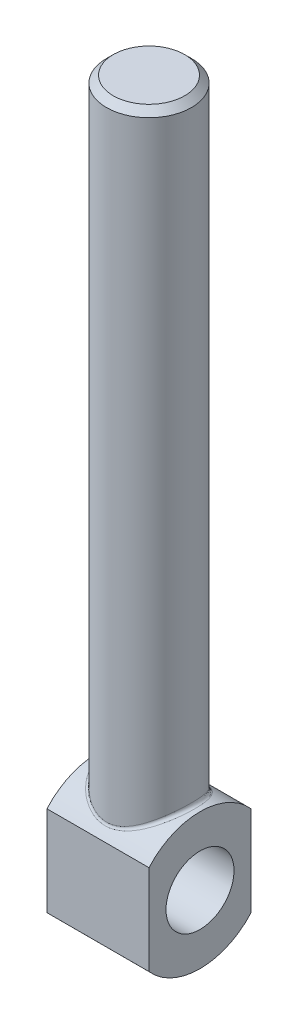
from build123d import *

# Parameters (mm, degrees)
SKETCH1_R           = 2.5
BOSS_EXTRUDE1_DEPTH = 40
SKETCH2_R           = 4
BOSS_EXTRUDE2_DEPTH = 3
CUT_EXTRUDE1_START  = -6
CUT_EXTRUDE1_DEPTH  = 6
SKETCH5_R           = 2
CUT_EXTRUDE2_DEPTH  = 41.558599702
FILLET1_R           = 0.2
CHAMFER1_SIZE       = 0.4
SPLIT1_START        = -3
SPLIT1_OUTLINE_R    = 2
SPLIT1_DEPTH        = 6
SPLIT1_2_OUTLINE_R  = 2
SPLIT1_2_DEPTH      = 6


# Read off the part's stored shape, not the designer's step: Split1
with BuildPart() as part:
    # Sketch1 → Boss-Extrude1 (new body)
    with BuildSketch(Plane(origin=(0, 0, 0), x_dir=(1, 0, 0), z_dir=(0, 1, 0))):
        with Locations(Location((0, 0, 0), (0, 0, 270))):
            Circle(SKETCH1_R)
    extrude(amount=BOSS_EXTRUDE1_DEPTH)

    # Sketch2 → Boss-Extrude2 (add, symmetric)
    with BuildSketch(Plane(origin=(0, 0, 0), x_dir=(0, 0, -1), z_dir=(1, 0, 0))):
        Circle(SKETCH2_R)
    extrude(amount=BOSS_EXTRUDE2_DEPTH, both=True)

    # Sketch3 → Cut-Extrude1 (cut)
    with BuildSketch(Plane.ZY.offset(3).offset(CUT_EXTRUDE1_START)):
        with BuildLine():
            ThreePointArc((-3, 2.645751311), (-4, 0), (-3, -2.645751311))
            Line((-3, -2.645751311), (-3, 2.645751311))
        make_face()
        with BuildLine():
            Line((3, 2.645751311), (3, -2.645751311))
            ThreePointArc((3, -2.645751311), (3.741657387, -1.414213562), (4, 0))
            ThreePointArc((4, 0), (3.741657387, 1.414213562), (3, 2.645751311))
        make_face()
    extrude(amount=CUT_EXTRUDE1_DEPTH, mode=Mode.SUBTRACT)

    # Sketch5 → Cut-Extrude2 (cut, through all)
    with BuildSketch(Plane.ZY.offset(3)):
        Circle(SKETCH5_R)
    extrude(amount=-CUT_EXTRUDE2_DEPTH, mode=Mode.SUBTRACT)

    # Fillet1
    fillet1_edges = [part.edges().sort_by_distance(p)[0] for p in [
        (0, 3.122498999, -2.5),
    ]]
    fillet(fillet1_edges, radius=FILLET1_R)

    # Chamfer1
    chamfer1_edges = [part.edges().sort_by_distance(p)[0] for p in [
        (0, 40, -2.5),
    ]]
    chamfer(chamfer1_edges, length=CHAMFER1_SIZE)

    # Split1 2 outline → Split1 2 (cut)
    with BuildSketch(Plane.YZ.offset(SPLIT1_START)):
        with BuildLine():
            ThreePointArc((3.063858732, -2.571530609), (3.999999989, 0.000302983), (3.063469131, 2.571994728))
            ThreePointArc((3.063469131, 2.571994728), (2.86262059, 2.793815197), (2.645751311, 3))
            Line((2.645751311, 3), (-2.645751311, 3))
            ThreePointArc((-2.645751311, 3), (-4, 0), (-2.645751311, -3))
            Line((-2.645751311, -3), (2.645751311, -3))
            ThreePointArc((2.645751311, -3), (2.862832202, -2.793598358), (3.063858732, -2.571530609))
        make_face()
        Circle(SPLIT1_2_OUTLINE_R, mode=Mode.SUBTRACT)
    extrude(amount=SPLIT1_2_DEPTH, mode=Mode.SUBTRACT)


with BuildPart() as body_2:
    # Split1 outline → Split1 (new body)
    with BuildSketch(Plane.YZ.offset(SPLIT1_START)):
        with BuildLine():
            ThreePointArc((2.645751311, -3), (4, 0), (2.645751311, 3))
            Line((2.645751311, 3), (-2.645751311, 3))
            ThreePointArc((-2.645751311, 3), (-4, 0), (-2.645751311, -3))
            Line((-2.645751311, -3), (2.645751311, -3))
        make_face()
        Circle(SPLIT1_OUTLINE_R, mode=Mode.SUBTRACT)
    extrude(amount=SPLIT1_DEPTH)


solid = Compound([part.part, body_2.part])
